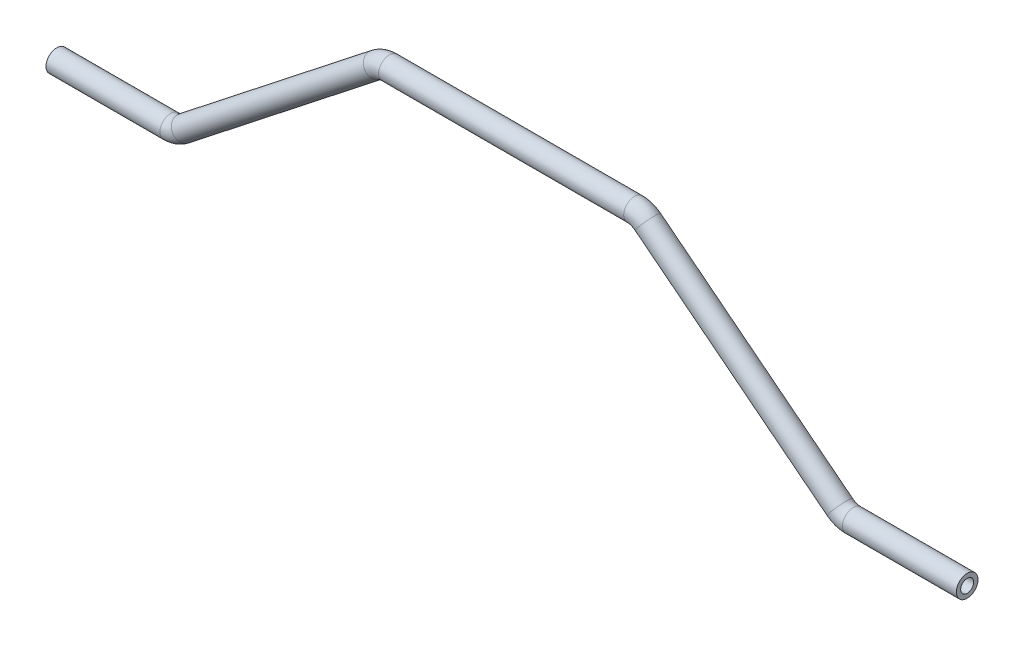
from build123d import *

# Parameters (mm, degrees)
SKETCH2_R   = 5
SKETCH2_R_2 = 3


with BuildPart() as part:
    # Sweep1: sweep along a path in Sketch1
    with BuildLine(Plane.XY) as sweep1_path:
        Line((210, -73.885714286), (157.459682683, -73.885714286))
        ThreePointArc((157.459682683, -73.885714286), (154.190143217, -73.336117012), (151.279989747, -71.747736622))
        Line((151.279989747, -71.747736622), (62.720010253, -2.137977664))
        ThreePointArc((62.720010253, -2.137977664), (59.809856783, -0.549597274), (56.540317317, 0))
        Line((56.540317317, 0), (-56.540317317, 0))
        ThreePointArc((-56.540317317, 0), (-59.809856783, -0.549597274), (-62.720010253, -2.137977664))
        Line((-62.720010253, -2.137977664), (-151.279989747, -71.747736622))
        ThreePointArc((-151.279989747, -71.747736622), (-154.190143217, -73.336117012), (-157.459682683, -73.885714286))
        Line((-157.459682683, -73.885714286), (-210, -73.885714286))
    # Sketch2 → Sweep1 (sweep)
    with BuildSketch(Plane(origin=(210, -73.885714286, 0), x_dir=(0, 0, -1), z_dir=(1, 0, 0))):
        with Locations((0, -0.042530313)):
            Circle(SKETCH2_R)
        with Locations((0, -0.042530313)):
            Circle(SKETCH2_R_2, mode=Mode.SUBTRACT)
    sweep(path=sweep1_path.line)


solid = part.part
